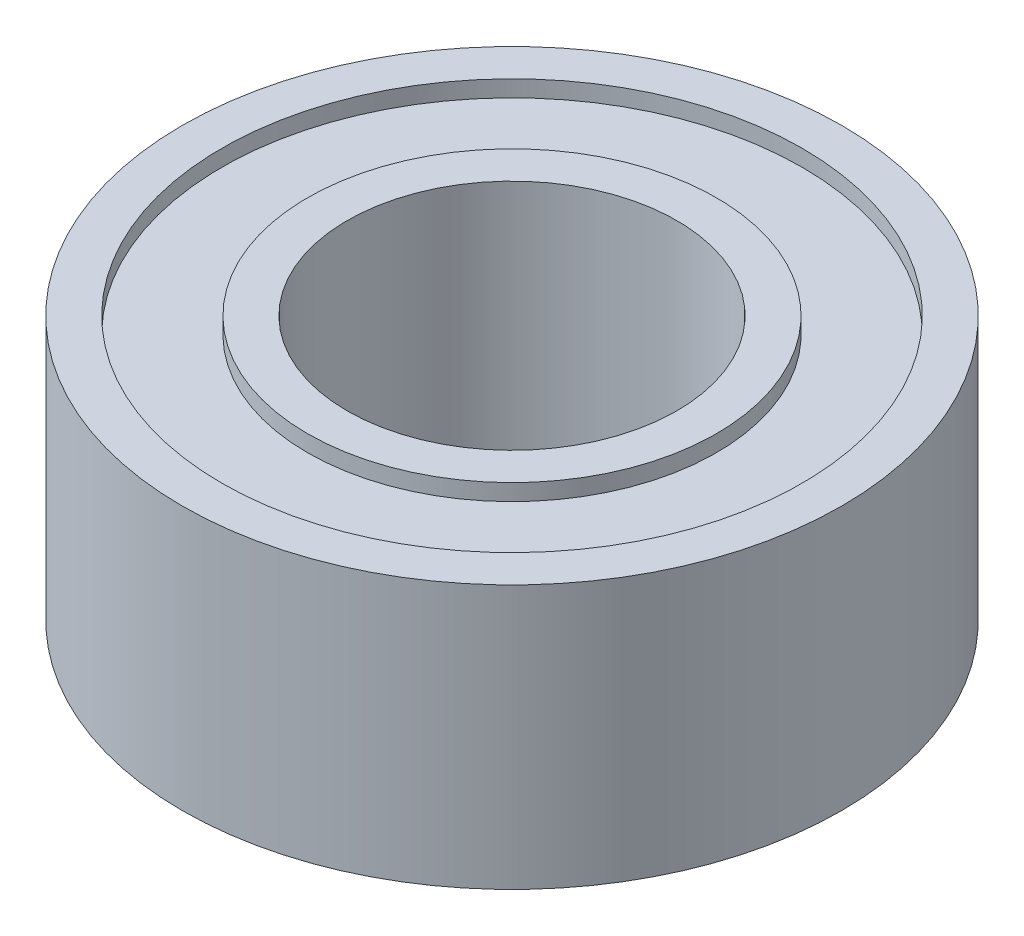
from build123d import *

# Parameters (mm, degrees)
SKETCH1_R           = 5
SKETCH1_R_2         = 2.5
BOSS_EXTRUDE1_DEPTH = 2
SKETCH2_R           = 4.4
SKETCH2_R_2         = 3.1
CUT_EXTRUDE1_DEPTH  = 0.25


with BuildPart() as part:
    # Sketch1 → Boss-Extrude1 (new, symmetric)
    with BuildSketch(Plane(origin=(0, 0, 0), x_dir=(1, 0, 0), z_dir=(0, 1, 0))):
        Circle(SKETCH1_R)
        Circle(SKETCH1_R_2, mode=Mode.SUBTRACT)
    extrude(amount=BOSS_EXTRUDE1_DEPTH, both=True)

    # Sketch2 → Cut-Extrude1 (cut)
    with BuildSketch(Plane(origin=(0, 2, 0), x_dir=(1, 0, 0), z_dir=(0, 1, 0))):
        Circle(SKETCH2_R)
        Circle(SKETCH2_R_2, mode=Mode.SUBTRACT)
    cut_extrude1 = extrude(amount=-CUT_EXTRUDE1_DEPTH, mode=Mode.SUBTRACT)

    # Mirror1: Cut-Extrude1 across plane
    add(cut_extrude1.mirror(Plane.ZX), mode=Mode.SUBTRACT)


solid = part.part
